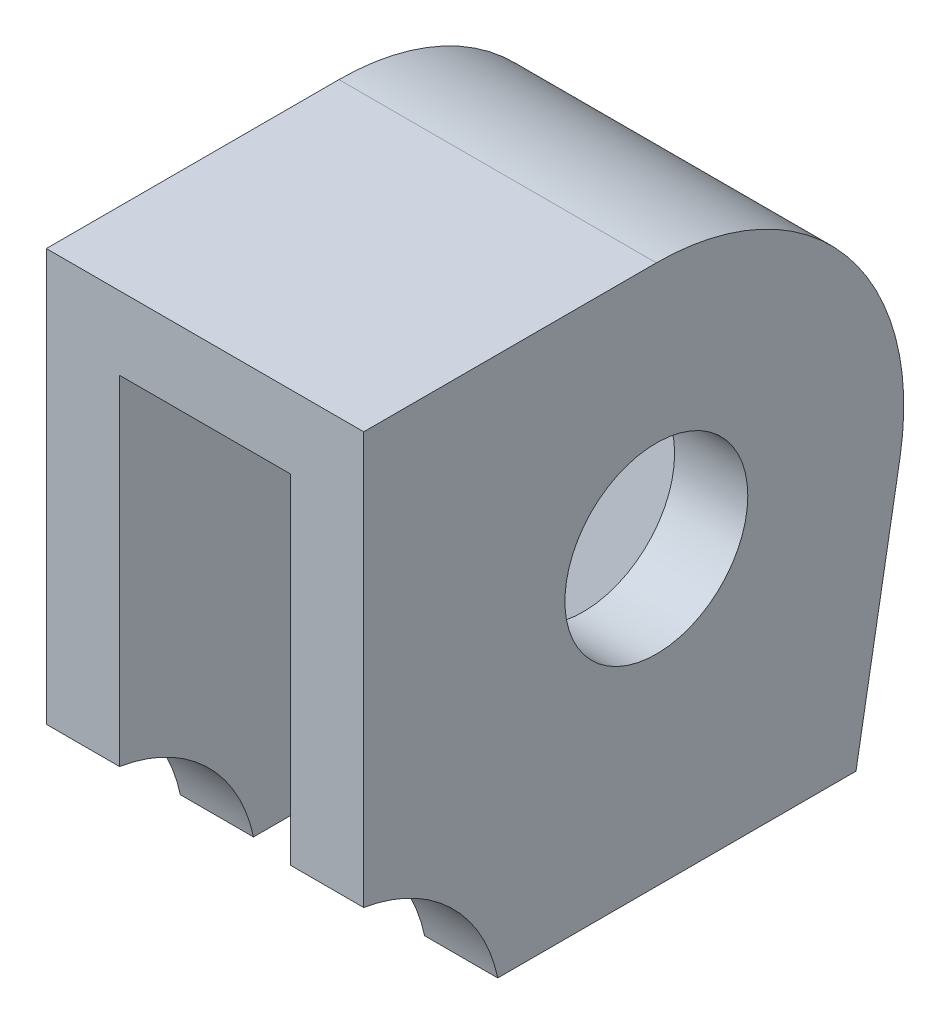
from build123d import *

# Parameters (mm, degrees)
BOSS_EXTRUDE1_DEPTH = 2
BOSS_EXTRUDE2_START = 2.338833665
BOSS_EXTRUDE2_DEPTH = 2.338833665
SKETCH4_R           = 2.5
CUT_EXTRUDE5_DEPTH  = 13


with BuildPart() as part:
    # Sketch1 → Boss-Extrude1 (new body)
    with BuildSketch(Plane(origin=(0, 0, 0), x_dir=(0, 0, -1), z_dir=(1, 0, 0))):
        with BuildLine():
            Line((-8, -4.5), (-8, 6.76462661))
            Line((-8, 6.76462661), (0, 6.76462661))
            ThreePointArc((0, 6.76462661), (5.182004624, 4.348218169), (6.661856732, -1.174665083))
            Line((6.661856732, -1.174665083), (5.458366034, -8))
            Line((5.458366034, -8), (-4.335665421, -8))
            ThreePointArc((-4.335665421, -8), (-5.628363986, -5.685201742), (-8, -4.5))
        make_face()
    extrude(amount=BOSS_EXTRUDE1_DEPTH)

    # Sketch6 → Boss-Extrude2 (add)
    with BuildSketch(Plane.ZY.offset(BOSS_EXTRUDE2_START)):
        with BuildLine():
            Line((8, 4.76462661), (0, 4.76462661))
            ThreePointArc((0, 4.76462661), (-3.649915738, 3.06264295), (-4.692241226, -0.827368728))
            Line((-4.692241226, -0.827368728), (-3.42751281, -8))
            Line((-3.42751281, -8), (-5.458366034, -8))
            Line((-5.458366034, -8), (-6.661856732, -1.174665083))
            ThreePointArc((-6.661856732, -1.174665083), (-5.182004624, 4.348218169), (0, 6.76462661))
            Line((0, 6.76462661), (8, 6.76462661))
            Line((8, 6.76462661), (8, 4.76462661))
        make_face()
    extrude(amount=-BOSS_EXTRUDE2_DEPTH)

    # Mirror1: part across plane


with BuildPart() as part_1:
    add(part.part)
    add(part.part.mirror(Plane.ZY.offset(2.338833665)))

    # Sketch4 → Cut-Extrude5 (cut)
    with BuildSketch(Plane(origin=(2, 0, 0), x_dir=(0, 0, -1), z_dir=(1, 0, 0))):
        Circle(SKETCH4_R)
    extrude(amount=-CUT_EXTRUDE5_DEPTH, mode=Mode.SUBTRACT)


solid = part_1.part
